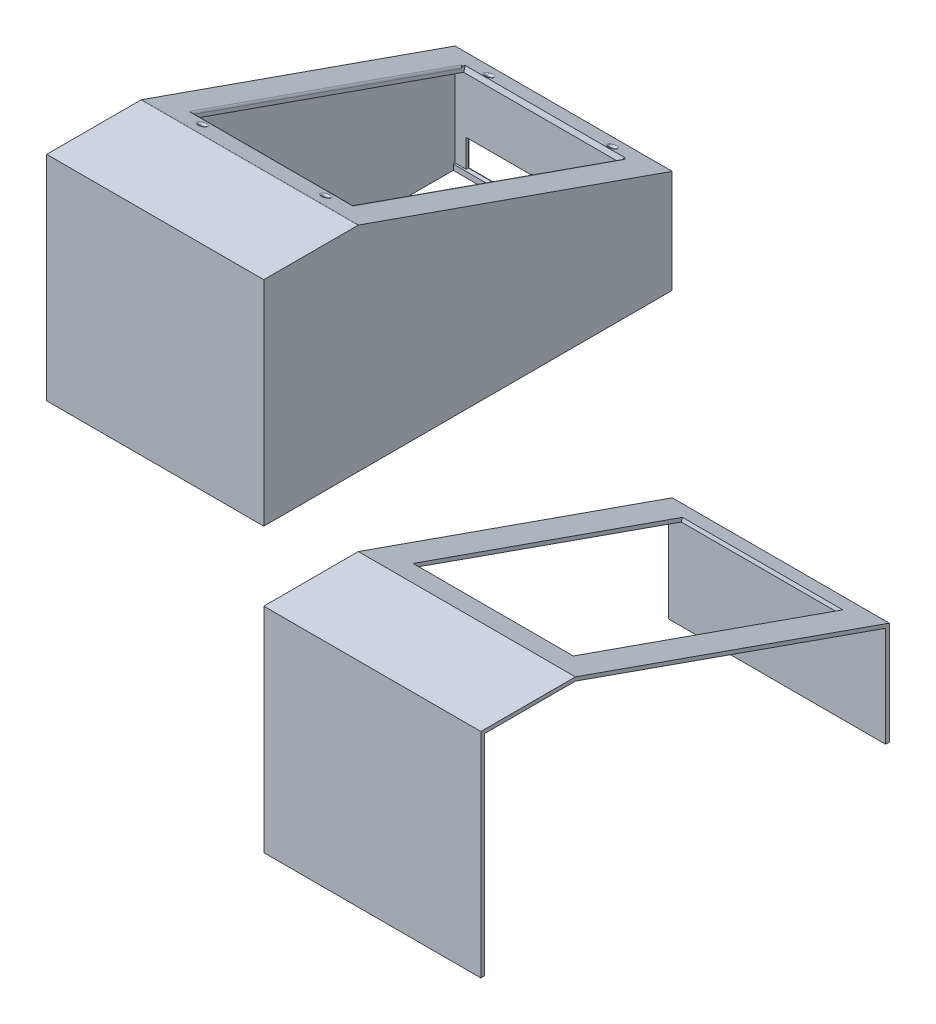
from build123d import *

# Parameters (mm, degrees)
BOSS_EXTRUDE1_DEPTH  = 118
SKETCH2_W            = 44
SKETCH2_H            = 22
CUT_EXTRUDE1_DEPTH   = 118
BOSS_EXTRUDE28_START = -2
SKETCH48_W           = 44
SKETCH48_H           = 2
BOSS_EXTRUDE28_DEPTH = 2
BOSS_EXTRUDE29_START = -2
SKETCH49_W           = 44
SKETCH49_H           = 2.5
BOSS_EXTRUDE29_DEPTH = 2
BOSS_EXTRUDE30_START = -2
SKETCH50_W           = 1.5
SKETCH50_H           = 17.5
SKETCH50_W_2         = 3.5
BOSS_EXTRUDE30_DEPTH = 2
BOSS_EXTRUDE31_START = -2
SKETCH51_W           = 39
SKETCH51_H           = 3.5
BOSS_EXTRUDE31_DEPTH = 2
SKETCH52_W           = 87.1
SKETCH52_H           = 155.2
CUT_EXTRUDE11_DEPTH  = 2
BOSS_EXTRUDE32_DEPTH = 118
SKETCH54_W           = 97.1
SKETCH54_H           = 175.2
BOSS_EXTRUDE33_DEPTH = 1
SKETCH55_W           = 87.1
SKETCH55_H           = 155.2
CUT_EXTRUDE12_DEPTH  = 1
SKETCH56_R           = 2.505902344
SKETCH56_R_2         = 1.5
CUT_EXTRUDE13_DEPTH  = 205.102182183
SKETCH57_R           = 2.505902344
BOSS_EXTRUDE35_DEPTH = 2.886718
SKETCH58_R           = 1.5
CUT_EXTRUDE14_DEPTH  = 205.102182183
SKETCH3_W            = 118
SKETCH3_H            = 2
BOSS_EXTRUDE2_DEPTH  = 114.04
SKETCH5_W            = 39
SKETCH5_H            = 10
BOSS_EXTRUDE3_DEPTH  = 10
SKETCH6_W            = 118
SKETCH6_H            = 2
BOSS_EXTRUDE4_DEPTH  = 1
SKETCH7_W            = 118
SKETCH7_H            = 3.96
CUT_EXTRUDE2_DEPTH   = 272.217672338
BOSS_EXTRUDE5_START  = -2
SKETCH8_W            = 39
SKETCH8_H            = 3
BOSS_EXTRUDE5_DEPTH  = 2
SKETCH9_W            = 2
SKETCH9_H            = 54.743388168
BOSS_EXTRUDE6_DEPTH  = 118
SKETCH12_W           = 44
SKETCH12_H           = 15.04
CUT_EXTRUDE4_DEPTH   = 116
SKETCH59_W           = 5
SKETCH59_H           = 5
CUT_EXTRUDE15_DEPTH  = 10
SKETCH13_W           = 2
SKETCH13_H           = 61.096967507
CUT_EXTRUDE5_DEPTH   = 221.843041507
SKETCH15_W           = 118
SKETCH15_H           = 3
BOSS_EXTRUDE7_DEPTH  = 1
BOSS_EXTRUDE13_DEPTH = 2
BOSS_EXTRUDE16_DEPTH = 2
FILLET9_R            = 1
FILLET10_R           = 1
SKETCH30_W           = 87.1
SKETCH30_H           = 155.2
CUT_EXTRUDE7_DEPTH   = 202.588290111
BOSS_EXTRUDE18_DEPTH = 2
BOSS_EXTRUDE19_DEPTH = 2
BOSS_EXTRUDE20_DEPTH = 118
SKETCH38_W           = 2
SKETCH38_H           = 2
BOSS_EXTRUDE21_DEPTH = 118
SKETCH39_W           = 2
SKETCH39_H           = 2
BOSS_EXTRUDE22_DEPTH = 118
SKETCH40_W           = 2
SKETCH40_H           = 2
BOSS_EXTRUDE23_DEPTH = 118
SKETCH41_W           = 2
SKETCH41_H           = 2
BOSS_EXTRUDE25_DEPTH = 88
BOSS_EXTRUDE26_DEPTH = 118
SKETCH46_W           = 87.1
SKETCH46_H           = 155.2
CUT_EXTRUDE10_DEPTH  = 118


with BuildPart() as part:
    # Sketch1 → Boss-Extrude1 (new body)
    with BuildSketch(Plane(origin=(0, 0, 0), x_dir=(0, 0, -1), z_dir=(1, 0, 0))):
        Polygon((157.338078292, 37.257523043), (50.338078292, 74.888790036), (-13.264734558, 97.257523043), (-64.661921708, 97.257523043), (-64.661921708, 95.257523043), (-13.264734558, 95.257523043), (157.338078292, 35.257523043), (157.338078292, -22.742476957), (159.338078292, -22.742476957), (159.338078292, 36.525800712), align=None)
    extrude(amount=BOSS_EXTRUDE1_DEPTH)

    # Sketch2 → Cut-Extrude1 (cut)
    with BuildSketch(Plane(origin=(0, 0, -159.338078292), x_dir=(-1, 0, 0), z_dir=(0, 0, -1))):
        with Locations((-30, -11.742476957)):
            Rectangle(SKETCH2_W, SKETCH2_H)
    extrude(amount=-CUT_EXTRUDE1_DEPTH, mode=Mode.SUBTRACT)

    # Sketch48 → Boss-Extrude28 (add)
    with BuildSketch(Plane(origin=(0, 0, -159.338078292), x_dir=(-1, 0, 0), z_dir=(0, 0, -1)).offset(BOSS_EXTRUDE28_START)):
        with Locations((-30, -1.742476957)):
            Rectangle(SKETCH48_W, SKETCH48_H)
    extrude(amount=BOSS_EXTRUDE28_DEPTH)

    # Sketch49 → Boss-Extrude29 (add)
    with BuildSketch(Plane(origin=(0, 0, -159.338078292), x_dir=(-1, 0, 0), z_dir=(0, 0, -1)).offset(BOSS_EXTRUDE29_START)):
        with Locations((-30, -3.992476957)):
            Rectangle(SKETCH49_W, SKETCH49_H)
    extrude(amount=BOSS_EXTRUDE29_DEPTH)

    # Sketch50 → Boss-Extrude30 (add)
    with BuildSketch(Plane(origin=(0, 0, -159.338078292), x_dir=(-1, 0, 0), z_dir=(0, 0, -1)).offset(BOSS_EXTRUDE30_START)):
        with Locations((-8.75, -13.992476957)):
            Rectangle(SKETCH50_W, SKETCH50_H)
        with Locations((-50.25, -13.992476957)):
            Rectangle(SKETCH50_W_2, SKETCH50_H)
    extrude(amount=BOSS_EXTRUDE30_DEPTH)

    # Sketch51 → Boss-Extrude31 (add)
    with BuildSketch(Plane(origin=(0, 0, -159.338078292), x_dir=(-1, 0, 0), z_dir=(0, 0, -1)).offset(BOSS_EXTRUDE31_START)):
        with Locations((-29, -20.992476957)):
            Rectangle(SKETCH51_W, SKETCH51_H)
    extrude(amount=BOSS_EXTRUDE31_DEPTH)

    # Sketch52 → Cut-Extrude11 (cut)
    with BuildSketch(Plane(origin=(0, 82.400394348, -28.979731215), x_dir=(1, 0, 0), z_dir=(0, 0.9433589794363793, -0.3317737721953818))):
        with Locations((59, 45.965220001)):
            Rectangle(SKETCH52_W, SKETCH52_H)
    extrude(amount=-CUT_EXTRUDE11_DEPTH, mode=Mode.SUBTRACT)

    # Sketch53 → Boss-Extrude32 (add)
    with BuildSketch(Plane.ZY):
        Polygon((-151.311566761, 39.377011496), (-159.338078292, 36.554134875), (-159.338078292, 36.373260975), (-153.749612575, 38.338691307), align=None)
    extrude(amount=-BOSS_EXTRUDE32_DEPTH)

    # Sketch54 → Boss-Extrude33 (add)
    with BuildSketch(Plane(origin=(0, 80.620542019, -28.35376768), x_dir=(1, 0, 0), z_dir=(0, -0.9433589794363793, 0.3317737721953817))):
        with Locations((59, -45.965220001)):
            Rectangle(SKETCH54_W, SKETCH54_H)
    extrude(amount=BOSS_EXTRUDE33_DEPTH)

    # Sketch55 → Cut-Extrude12 (cut)
    with BuildSketch(Plane(origin=(0, 80.620542019, -28.35376768), x_dir=(1, 0, 0), z_dir=(0, 0.9433589794363793, -0.3317737721953818))):
        with Locations((59, 45.965220001)):
            Rectangle(SKETCH55_W, SKETCH55_H)
    extrude(amount=-CUT_EXTRUDE12_DEPTH, mode=Mode.SUBTRACT)

    # Sketch56 → Cut-Extrude13 (cut, through all)
    with BuildSketch(Plane(origin=(0, 79.67718304, -28.021993908), x_dir=(1, 0, 0), z_dir=(0, -0.9433589794363793, 0.3317737721953818))):
        with Locations(Location((92.55, 36.634779999, 0), (0, 0, 270))):
            Circle(SKETCH56_R)
        with Locations(Location((25.45, 36.634779999, 0), (0, 0, 270))):
            Circle(SKETCH56_R_2)
        with Locations(Location((25.45, -128.565220001, 0), (0, 0, 270))):
            Circle(SKETCH56_R_2)
        with Locations(Location((92.55, -128.565220001, 0), (0, 0, 270))):
            Circle(SKETCH56_R_2)
    extrude(amount=-CUT_EXTRUDE13_DEPTH, mode=Mode.SUBTRACT)

    # Sketch57 → Boss-Extrude35 (add)
    with BuildSketch(Plane(origin=(0, 79.67718304, -28.021993908), x_dir=(1, 0, 0), z_dir=(0, -0.9433589794363793, 0.3317737721953818))):
        with Locations((92.55, 36.634779999)):
            Circle(SKETCH57_R)
    extrude(amount=-BOSS_EXTRUDE35_DEPTH)

    # Sketch58 → Cut-Extrude14 (cut, through all)
    with BuildSketch(Plane(origin=(0, 79.67718304, -28.021993908), x_dir=(1, 0, 0), z_dir=(0, -0.9433589794363793, 0.3317737721953818))):
        with Locations(Location((92.55, 36.634779999, 0), (0, 0, 270))):
            Circle(SKETCH58_R)
    extrude(amount=-CUT_EXTRUDE14_DEPTH, mode=Mode.SUBTRACT)

    # Sketch3 → Boss-Extrude2 (add)
    with BuildSketch(Plane.XZ.offset(-95.257523043)):
        with Locations((59, 63.661921708)):
            Rectangle(SKETCH3_W, SKETCH3_H)
    extrude(amount=BOSS_EXTRUDE2_DEPTH)

    # Sketch5 → Boss-Extrude3 (add)
    with BuildSketch(Plane.XY.offset(64.661921708)):
        with Locations((88.5, -13.782476957)):
            Rectangle(SKETCH5_W, SKETCH5_H)
    extrude(amount=-BOSS_EXTRUDE3_DEPTH)

    # Sketch6 → Boss-Extrude4 (add)
    with BuildSketch(Plane(origin=(0, 0, 62.661921708), x_dir=(-1, 0, 0), z_dir=(0, 0, -1))):
        with Locations((-59, -17.782476957)):
            Rectangle(SKETCH6_W, SKETCH6_H)
    extrude(amount=BOSS_EXTRUDE4_DEPTH)

    # Sketch7 → Cut-Extrude2 (cut, through all)
    with BuildSketch(Plane.XY.offset(64.661921708)):
        with Locations((59, -20.762476957)):
            Rectangle(SKETCH7_W, SKETCH7_H)
    extrude(amount=-CUT_EXTRUDE2_DEPTH, mode=Mode.SUBTRACT)

    # Sketch8 → Boss-Extrude5 (add)
    with BuildSketch(Plane(origin=(0, 0, -159.338078292), x_dir=(-1, 0, 0), z_dir=(0, 0, -1)).offset(BOSS_EXTRUDE5_START)):
        with Locations((-29, -17.282476957)):
            Rectangle(SKETCH8_W, SKETCH8_H)
    extrude(amount=BOSS_EXTRUDE5_DEPTH)

    # Sketch9 → Boss-Extrude6 (add)
    with BuildSketch(Plane.ZY):
        with Locations((-156.338078292, 8.589217127)):
            Rectangle(SKETCH9_W, SKETCH9_H)
    extrude(amount=-BOSS_EXTRUDE6_DEPTH)

    # Sketch12 → Cut-Extrude4 (cut)
    with BuildSketch(Plane(origin=(0, 0, -157.338078292), x_dir=(-1, 0, 0), z_dir=(0, 0, -1))):
        with Locations((-30, -8.262476957)):
            Rectangle(SKETCH12_W, SKETCH12_H)
    extrude(amount=-CUT_EXTRUDE4_DEPTH, mode=Mode.SUBTRACT)

    # Sketch59 → Cut-Extrude15 (cut)
    with BuildSketch(Plane(origin=(0, 0, -159.338078292), x_dir=(-1, 0, 0), z_dir=(0, 0, -1))):
        with Locations((-46, -2.742476957)):
            Rectangle(SKETCH59_W, SKETCH59_H)
    extrude(amount=-CUT_EXTRUDE15_DEPTH, mode=Mode.SUBTRACT)

    # Sketch13 → Cut-Extrude5 (cut, through all)
    with BuildSketch(Plane.ZY):
        with Locations((-158.338078292, 11.766006797)):
            Rectangle(SKETCH13_W, SKETCH13_H)
    extrude(amount=-CUT_EXTRUDE5_DEPTH, mode=Mode.SUBTRACT)

    # Sketch15 → Boss-Extrude7 (add)
    with BuildSketch(Plane.XY.offset(-155.338078292)):
        with Locations((59, -17.282476957)):
            Rectangle(SKETCH15_W, SKETCH15_H)
    extrude(amount=BOSS_EXTRUDE7_DEPTH)

    # Sketch26 → Boss-Extrude13 (add)
    with BuildSketch(Plane(origin=(118, 0, 0), x_dir=(0, 0, -1), z_dir=(1, 0, 0))):
        Polygon((-64.661921708, -18.782476957), (-64.661921708, 97.257523043), (-13.264734558, 97.257523043), (157.338078292, 37.257523043), (157.338078292, -18.782476957), align=None)
    extrude(amount=-BOSS_EXTRUDE13_DEPTH)

    # Sketch28 → Boss-Extrude16 (add)
    with BuildSketch(Plane.ZY):
        Polygon((64.661921708, -18.782476957), (64.661921708, 97.257523043), (13.264734558, 97.257523043), (-157.338078292, 37.257523043), (-157.338078292, -18.782476957), align=None)
    extrude(amount=-BOSS_EXTRUDE16_DEPTH)

    # Fillet9
    fillet9_edges = [part.edges().sort_by_distance(p)[0] for p in [
        (0, 39.237523043, 64.661921708),
        (0, 97.257523043, 38.963328133),
        (15.45, 67.150339918, -72.341434245),
        (59, 92.89598464, 0.86322256),
        (102.55, 67.150339918, -72.341434245),
        (59, 41.404695196, -145.546091049),
        (59, 97.257523043, 13.264734558),
        (59, 97.257523043, 64.661921708),
        (92.55, 40.243486993, -148.847847477),
        (25.45, 40.243486993, -148.847847477),
        (25.45, 95.05251416, 6.995055926),
        (92.55, 95.05251416, 6.995055926),
        (0, -18.782476957, -46.338078292),
        (118, -18.782476957, -46.338078292),
        (59, -18.782476957, 64.661921708),
        (30, -15.782476957, -157.338078292),
        (8, -8.262476957, -157.338078292),
        (25.75, -0.742476957, -157.338078292),
        (52, -8.262476957, -157.338078292),
        (50.25, -0.742476957, -157.338078292),
        (43.5, -0.492476957, -157.338078292),
        (0, 67.257523043, -72.036671867),
        (118, 67.257523043, -72.036671867),
        (0, 9.237523043, -157.338078292),
        (46, -0.242476957, -157.338078292),
        (118, 9.237523043, -157.338078292),
        (59, 37.257523043, -157.338078292),
        (48.5, -0.492476957, -157.338078292),
        (59, -18.782476957, -157.338078292),
        (118, 97.257523043, 38.963328133),
        (118, 39.237523043, 64.661921708),
    ]]
    fillet(fillet9_edges, radius=FILLET9_R)

    # Fillet10
    # the kernel refuses this fillet: 1 mm, written as the material it adds along each edge
    with BuildSketch(Plane(origin=(3, 94.257523043, 13.435456373), x_dir=(0, 1, 0), z_dir=(-1, 0, 0))) as fillet10_piece_1_section:
        Polygon((0, 0), (FILLET10_R * 1.02, 0), (FILLET10_R * 1.02, FILLET10_R * 0.174136251315), (FILLET10_R * 0.962226159025, FILLET10_R * 0.338409247639), align=None)
    fillet10_piece_1 = extrude(amount=FILLET10_R * 1.02, mode=Mode.PRIVATE)
    fillet10_piece_1 = fillet10_piece_1 - Plane(origin=(3, 94.257523043, 13.435456373), x_dir=(0, -0.9857380431525353, 0.16828698785648993), z_dir=(-1, 0, 0)) * Sphere(FILLET10_R, mode=Mode.PRIVATE)
    add(fillet10_piece_1)
    with BuildSketch(Plane(origin=(115, 94.257523043, 13.435456373), x_dir=(0, 0.9433589794363793, -0.33177377219538173), z_dir=(1, 0, 0))) as fillet10_piece_2_section:
        Polygon((0, 0), (FILLET10_R * 1.02, 0), (FILLET10_R * 1.02, FILLET10_R * 0.174136251315), (FILLET10_R * 0.962226159025, FILLET10_R * 0.338409247639), align=None)
    fillet10_piece_2 = extrude(amount=FILLET10_R * 1.02, mode=Mode.PRIVATE)
    fillet10_piece_2 = fillet10_piece_2 - Plane(origin=(115, 94.257523043, 13.435456373), x_dir=(0, -0.9857380431525353, 0.16828698785648993), z_dir=(1, 0, 0)) * Sphere(FILLET10_R, mode=Mode.PRIVATE)
    add(fillet10_piece_2)
    with BuildSketch(Plane(origin=(115, 94.257523043, 61.661921708), x_dir=(0, 0, 1), z_dir=(1, 0, 0))) as fillet10_piece_3_section:
        Polygon((0, 0), (FILLET10_R * 1.02, 0), (FILLET10_R * 1.02, -FILLET10_R * 1.02), (0, -FILLET10_R * 1.02), align=None)
    fillet10_piece_3 = extrude(amount=FILLET10_R * 1.02, mode=Mode.PRIVATE)
    fillet10_piece_3 = fillet10_piece_3 - Plane(origin=(115, 94.257523043, 61.661921708), x_dir=(0, -0.7071067811865475, -0.7071067811865475), z_dir=(1, 0, 0)) * Sphere(FILLET10_R, mode=Mode.PRIVATE)
    add(fillet10_piece_3)
    with BuildSketch(Plane(origin=(3, 94.257523043, 61.661921708), x_dir=(-1, 0, 0), z_dir=(0, 0, 1))) as fillet10_piece_4_section:
        Polygon((0, 0), (FILLET10_R * 1.02, 0), (FILLET10_R * 1.02, -FILLET10_R * 1.02), (0, -FILLET10_R * 1.02), align=None)
    fillet10_piece_4 = extrude(amount=FILLET10_R * 1.02, mode=Mode.PRIVATE)
    fillet10_piece_4 = fillet10_piece_4 - Plane(origin=(3, 94.257523043, 61.661921708), x_dir=(0.7071067811865475, -0.7071067811865475, 0), z_dir=(0, 0, 1)) * Sphere(FILLET10_R, mode=Mode.PRIVATE)
    add(fillet10_piece_4)
    with BuildSketch(Plane(origin=(3, 95.257523043, 13.264734558), x_dir=(0, -0.3317737721953566, -0.943358979436388), z_dir=(1, 0, 0))) as fillet10_piece_5:
        with BuildLine():
            CenterArc((FILLET10_R * 0.170721815015, -FILLET10_R), FILLET10_R, 90, 19.376471652)
            Line((-FILLET10_R * 0.16105195718, -FILLET10_R * 0.0566410205636), (-FILLET10_R * 0.167687432624, -FILLET10_R * 0.0377738409749))
            Line((-FILLET10_R * 0.167687432624, -FILLET10_R * 0.0377738409749), (-FILLET10_R * 0.0034144363003, FILLET10_R * 0.02))
            Line((-FILLET10_R * 0.0034144363003, FILLET10_R * 0.02), (FILLET10_R * 0.170721815015, FILLET10_R * 0.02))
            Line((FILLET10_R * 0.170721815015, FILLET10_R * 0.02), (FILLET10_R * 0.170721815015, 0))
        make_face()
    extrude(amount=112)
    with BuildSketch(Plane(origin=(116, 35.131476781, -157.69647574), x_dir=(-1, 0, 0), z_dir=(0, 0.33177377219538173, 0.9433589794363793))) as fillet10_piece_6_section:
        with BuildLine():
            CenterArc((FILLET10_R, FILLET10_R), FILLET10_R, 180, 90)
            Line((0, FILLET10_R), (-FILLET10_R * 0.02, FILLET10_R))
            Line((-FILLET10_R * 0.02, FILLET10_R), (-FILLET10_R * 0.02, -FILLET10_R * 0.02))
            Line((-FILLET10_R * 0.02, -FILLET10_R * 0.02), (FILLET10_R, -FILLET10_R * 0.02))
            Line((FILLET10_R, -FILLET10_R * 0.02), (FILLET10_R, 0))
        make_face()
    fillet10_piece_6 = extrude(amount=181.055316231, mode=Mode.PRIVATE)
    fillet10_piece_6 = split(fillet10_piece_6, bisect_by=Plane(origin=(115.773658942, 65.354024879, -155.338078292), z_dir=(0, 0, 1)), keep=Keep.TOP, mode=Mode.PRIVATE)
    add(fillet10_piece_6)
    with BuildSketch(Plane(origin=(2, 35.960911211, -155.338078292), x_dir=(0, 0.3317737721953593, 0.9433589794363871), z_dir=(1, 0, 0))) as fillet10_piece_7:
        with BuildLine():
            CenterArc((FILLET10_R * 0.708347768316, FILLET10_R), FILLET10_R, 199.376471652, 70.623528348)
            Line((-FILLET10_R * 0.23501121112, FILLET10_R * 0.668226227805), (-FILLET10_R * 0.253878390709, FILLET10_R * 0.661590752361))
            Line((-FILLET10_R * 0.253878390709, FILLET10_R * 0.661590752361), (-FILLET10_R * 0.0141669553663, -FILLET10_R * 0.02))
            Line((-FILLET10_R * 0.0141669553663, -FILLET10_R * 0.02), (FILLET10_R * 0.708347768316, -FILLET10_R * 0.02))
            Line((FILLET10_R * 0.708347768316, -FILLET10_R * 0.02), (FILLET10_R * 0.708347768316, 0))
        make_face()
    extrude(amount=114)
    with BuildSketch(Plane(origin=(2, 35.131476781, -157.69647574), x_dir=(1, 0, 0), z_dir=(0, 0.33177377219538173, 0.9433589794363793))) as fillet10_piece_8_section:
        with BuildLine():
            CenterArc((FILLET10_R, -FILLET10_R), FILLET10_R, 90, 90)
            Line((0, -FILLET10_R), (-FILLET10_R * 0.02, -FILLET10_R))
            Line((-FILLET10_R * 0.02, -FILLET10_R), (-FILLET10_R * 0.02, FILLET10_R * 0.02))
            Line((-FILLET10_R * 0.02, FILLET10_R * 0.02), (FILLET10_R, FILLET10_R * 0.02))
            Line((FILLET10_R, FILLET10_R * 0.02), (FILLET10_R, 0))
        make_face()
    fillet10_piece_8 = extrude(amount=181.055316231, mode=Mode.PRIVATE)
    fillet10_piece_8 = split(fillet10_piece_8, bisect_by=Plane(origin=(2.226341058, 65.354024879, -155.338078292), z_dir=(0, 0, 1)), keep=Keep.TOP, mode=Mode.PRIVATE)
    add(fillet10_piece_8)
    with BuildSketch(Plane(origin=(116, 95.257523043, 13.435456373), x_dir=(0, -1, 0), z_dir=(0, 0, 1))) as fillet10_piece_9:
        with BuildLine():
            CenterArc((FILLET10_R, -FILLET10_R), FILLET10_R, 90, 90)
            Line((0, -FILLET10_R), (-FILLET10_R * 0.02, -FILLET10_R))
            Line((-FILLET10_R * 0.02, -FILLET10_R), (-FILLET10_R * 0.02, FILLET10_R * 0.02))
            Line((-FILLET10_R * 0.02, FILLET10_R * 0.02), (FILLET10_R, FILLET10_R * 0.02))
            Line((FILLET10_R, FILLET10_R * 0.02), (FILLET10_R, 0))
        make_face()
    extrude(amount=48.226465336)
    with BuildSketch(Plane(origin=(116, -16.782476957, 62.661921708), x_dir=(0, 0, -1), z_dir=(0, 1, 0))) as fillet10_piece_10:
        with BuildLine():
            CenterArc((FILLET10_R, FILLET10_R), FILLET10_R, 180, 90)
            Line((0, FILLET10_R), (-FILLET10_R * 0.02, FILLET10_R))
            Line((-FILLET10_R * 0.02, FILLET10_R), (-FILLET10_R * 0.02, -FILLET10_R * 0.02))
            Line((-FILLET10_R * 0.02, -FILLET10_R * 0.02), (FILLET10_R, -FILLET10_R * 0.02))
            Line((FILLET10_R, -FILLET10_R * 0.02), (FILLET10_R, 0))
        make_face()
    extrude(amount=111.04)
    with BuildSketch(Plane(origin=(2, -16.782476957, 62.661921708), x_dir=(0, 0, -1), z_dir=(0, 1, 0))) as fillet10_piece_11:
        with BuildLine():
            CenterArc((FILLET10_R, -FILLET10_R), FILLET10_R, 90, 90)
            Line((0, -FILLET10_R), (-FILLET10_R * 0.02, -FILLET10_R))
            Line((-FILLET10_R * 0.02, -FILLET10_R), (-FILLET10_R * 0.02, FILLET10_R * 0.02))
            Line((-FILLET10_R * 0.02, FILLET10_R * 0.02), (FILLET10_R, FILLET10_R * 0.02))
            Line((FILLET10_R, FILLET10_R * 0.02), (FILLET10_R, 0))
        make_face()
    extrude(amount=111.04)
    with BuildSketch(Plane(origin=(115, 95.257523043, 62.661921708), x_dir=(0, 0, -1), z_dir=(-1, 0, 0))) as fillet10_piece_12:
        with BuildLine():
            CenterArc((FILLET10_R, FILLET10_R), FILLET10_R, 180, 90)
            Line((0, FILLET10_R), (-FILLET10_R * 0.02, FILLET10_R))
            Line((-FILLET10_R * 0.02, FILLET10_R), (-FILLET10_R * 0.02, -FILLET10_R * 0.02))
            Line((-FILLET10_R * 0.02, -FILLET10_R * 0.02), (FILLET10_R, -FILLET10_R * 0.02))
            Line((FILLET10_R, -FILLET10_R * 0.02), (FILLET10_R, 0))
        make_face()
    extrude(amount=112)
    with BuildSketch(Plane(origin=(2, 95.257523043, 13.435456373), x_dir=(0, -1, 0), z_dir=(0, 0, 1))) as fillet10_piece_13:
        with BuildLine():
            CenterArc((FILLET10_R, FILLET10_R), FILLET10_R, 180, 90)
            Line((0, FILLET10_R), (-FILLET10_R * 0.02, FILLET10_R))
            Line((-FILLET10_R * 0.02, FILLET10_R), (-FILLET10_R * 0.02, -FILLET10_R * 0.02))
            Line((-FILLET10_R * 0.02, -FILLET10_R * 0.02), (FILLET10_R, -FILLET10_R * 0.02))
            Line((FILLET10_R, -FILLET10_R * 0.02), (FILLET10_R, 0))
        make_face()
    extrude(amount=48.226465336)
    with BuildSketch(Plane(origin=(107.55, 94.433870034, 10.922775888), x_dir=(0, -0.9433589794363803, 0.3317737721953789), z_dir=(-1, 0, 0)), Plane(origin=(10.45, 36.307105145, -154.353717309), x_dir=(0, -0.9433589794363769, 0.3317737721953884), z_dir=(1, 0, 0))) as fillet10_piece_14:
        with BuildLine():
            CenterArc((FILLET10_R, FILLET10_R), FILLET10_R, 180, 90)
            Line((0, FILLET10_R), (-FILLET10_R * 0.02, FILLET10_R))
            Line((-FILLET10_R * 0.02, FILLET10_R), (-FILLET10_R * 0.02, -FILLET10_R * 0.02))
            Line((-FILLET10_R * 0.02, -FILLET10_R * 0.02), (FILLET10_R, -FILLET10_R * 0.02))
            Line((FILLET10_R, -FILLET10_R * 0.02), (FILLET10_R, 0))
        make_face()
    extrude(amount=97.1)
    with BuildSketch(Plane(origin=(10.45, 94.433870034, 10.922775888), x_dir=(0, -0.9433589794363793, 0.3317737721953817), z_dir=(0, -0.3317737721953817, -0.9433589794363793)), Plane(origin=(107.55, 36.307105145, -154.353717309), x_dir=(0, -0.9433589794363793, 0.33177377219538173), z_dir=(0, 0.3317737721953817, 0.9433589794363793))) as fillet10_piece_15:
        with BuildLine():
            CenterArc((FILLET10_R, FILLET10_R), FILLET10_R, 180, 90)
            Line((0, FILLET10_R), (-FILLET10_R * 0.02, FILLET10_R))
            Line((-FILLET10_R * 0.02, FILLET10_R), (-FILLET10_R * 0.02, -FILLET10_R * 0.02))
            Line((-FILLET10_R * 0.02, -FILLET10_R * 0.02), (FILLET10_R, -FILLET10_R * 0.02))
            Line((FILLET10_R, -FILLET10_R * 0.02), (FILLET10_R, 0))
        make_face()
    extrude(amount=175.2)
    with BuildSketch(Plane(origin=(2, 35.960911211, -155.338078292), x_dir=(0, 0.3317737721953593, 0.9433589794363871), z_dir=(1, 0, 0))) as fillet10_piece_16a_section:
        with BuildLine():
            CenterArc((FILLET10_R * 0.708347768316, FILLET10_R), FILLET10_R, 199.376471652, 70.623528348)
            Line((-FILLET10_R * 0.23501121112, FILLET10_R * 0.668226227805), (-FILLET10_R * 0.253878390709, FILLET10_R * 0.661590752361))
            Line((-FILLET10_R * 0.253878390709, FILLET10_R * 0.661590752361), (-FILLET10_R * 0.0141669553663, -FILLET10_R * 0.02))
            Line((-FILLET10_R * 0.0141669553663, -FILLET10_R * 0.02), (FILLET10_R * 0.708347768316, -FILLET10_R * 0.02))
            Line((FILLET10_R * 0.708347768316, -FILLET10_R * 0.02), (FILLET10_R * 0.708347768316, 0))
        make_face()
    fillet10_piece_16a = extrude(amount=115.770869421, mode=Mode.PRIVATE)
    fillet10_piece_16a = split(fillet10_piece_16a, bisect_by=Plane(origin=(116, 35.857039201, -155.191438443), z_dir=(1, 0, 0)), keep=Keep.TOP, mode=Mode.PRIVATE)
    with BuildSketch(Plane(origin=(116, 35.131476781, -157.69647574), x_dir=(-1, 0, 0), z_dir=(0, 0.33177377219538173, 0.9433589794363793))) as fillet10_piece_16b_section:
        with BuildLine():
            CenterArc((FILLET10_R, FILLET10_R), FILLET10_R, 180, 90)
            Line((0, FILLET10_R), (-FILLET10_R * 0.02, FILLET10_R))
            Line((-FILLET10_R * 0.02, FILLET10_R), (-FILLET10_R * 0.02, -FILLET10_R * 0.02))
            Line((-FILLET10_R * 0.02, -FILLET10_R * 0.02), (FILLET10_R, -FILLET10_R * 0.02))
            Line((FILLET10_R, -FILLET10_R * 0.02), (FILLET10_R, 0))
        make_face()
    fillet10_piece_16b = extrude(amount=181.055316231, mode=Mode.PRIVATE)
    fillet10_piece_16b = split(fillet10_piece_16b, bisect_by=Plane(origin=(115.769615277, 35.326178707, -155.338078292), z_dir=(0, 0, -1)), keep=Keep.TOP, mode=Mode.PRIVATE)
    fillet10_piece_16 = fillet10_piece_16a & fillet10_piece_16b
    add(fillet10_piece_16)
    with BuildSketch(Plane(origin=(2, 35.131476781, -157.69647574), x_dir=(1, 0, 0), z_dir=(0, 0.33177377219538173, 0.9433589794363793))) as fillet10_piece_17a_section:
        with BuildLine():
            CenterArc((FILLET10_R, -FILLET10_R), FILLET10_R, 90, 90)
            Line((0, -FILLET10_R), (-FILLET10_R * 0.02, -FILLET10_R))
            Line((-FILLET10_R * 0.02, -FILLET10_R), (-FILLET10_R * 0.02, FILLET10_R * 0.02))
            Line((-FILLET10_R * 0.02, FILLET10_R * 0.02), (FILLET10_R, FILLET10_R * 0.02))
            Line((FILLET10_R, FILLET10_R * 0.02), (FILLET10_R, 0))
        make_face()
    fillet10_piece_17a = extrude(amount=181.055316231, mode=Mode.PRIVATE)
    fillet10_piece_17a = split(fillet10_piece_17a, bisect_by=Plane(origin=(2.230384723, 35.326178707, -155.338078292), z_dir=(0, 0, -1)), keep=Keep.TOP, mode=Mode.PRIVATE)
    with BuildSketch(Plane(origin=(0.229130579, 35.960911211, -155.338078292), x_dir=(0, 0.3317737721953682, 0.9433589794363839), z_dir=(1, 0, 0))) as fillet10_piece_17b_section:
        with BuildLine():
            CenterArc((FILLET10_R * 0.708347768316, FILLET10_R), FILLET10_R, 199.376471652, 70.623528348)
            Line((-FILLET10_R * 0.23501121112, FILLET10_R * 0.668226227805), (-FILLET10_R * 0.253878390709, FILLET10_R * 0.661590752361))
            Line((-FILLET10_R * 0.253878390709, FILLET10_R * 0.661590752361), (-FILLET10_R * 0.0141669553663, -FILLET10_R * 0.02))
            Line((-FILLET10_R * 0.0141669553663, -FILLET10_R * 0.02), (FILLET10_R * 0.708347768316, -FILLET10_R * 0.02))
            Line((FILLET10_R * 0.708347768316, -FILLET10_R * 0.02), (FILLET10_R * 0.708347768316, 0))
        make_face()
    fillet10_piece_17b = extrude(amount=115.770869421, mode=Mode.PRIVATE)
    fillet10_piece_17b = split(fillet10_piece_17b, bisect_by=Plane(origin=(2, 35.857039201, -155.191438443), z_dir=(-1, 0, 0)), keep=Keep.TOP, mode=Mode.PRIVATE)
    fillet10_piece_17 = fillet10_piece_17a & fillet10_piece_17b
    add(fillet10_piece_17)
    with BuildSketch(Plane(origin=(107.55, 36.307105145, -154.353717309), x_dir=(0, -0.9433589794363793, 0.33177377219538173), z_dir=(0, 0.3317737721953817, 0.9433589794363793))) as fillet10_piece_18a_section:
        with BuildLine():
            CenterArc((FILLET10_R, FILLET10_R), FILLET10_R, 180, 90)
            Line((0, FILLET10_R), (-FILLET10_R * 0.02, FILLET10_R))
            Line((-FILLET10_R * 0.02, FILLET10_R), (-FILLET10_R * 0.02, -FILLET10_R * 0.02))
            Line((-FILLET10_R * 0.02, -FILLET10_R * 0.02), (FILLET10_R, -FILLET10_R * 0.02))
            Line((FILLET10_R, -FILLET10_R * 0.02), (FILLET10_R, 0))
        make_face()
    fillet10_piece_18a = extrude(amount=177.7, mode=Mode.PRIVATE)
    fillet10_piece_18a = split(fillet10_piece_18a, bisect_by=Plane(origin=(107.776395114, 94.22029817, 10.997887849), z_dir=(0, 0.3317737721953817, 0.9433589794363793)), keep=Keep.TOP, mode=Mode.PRIVATE)
    with BuildSketch(Plane(origin=(110.05, 94.433870034, 10.922775888), x_dir=(0, -0.9433589794363803, 0.3317737721953789), z_dir=(-1, 0, 0))) as fillet10_piece_18b_section:
        with BuildLine():
            CenterArc((FILLET10_R, FILLET10_R), FILLET10_R, 180, 90)
            Line((0, FILLET10_R), (-FILLET10_R * 0.02, FILLET10_R))
            Line((-FILLET10_R * 0.02, FILLET10_R), (-FILLET10_R * 0.02, -FILLET10_R * 0.02))
            Line((-FILLET10_R * 0.02, -FILLET10_R * 0.02), (FILLET10_R, -FILLET10_R * 0.02))
            Line((FILLET10_R, -FILLET10_R * 0.02), (FILLET10_R, 0))
        make_face()
    fillet10_piece_18b = extrude(amount=99.6, mode=Mode.PRIVATE)
    fillet10_piece_18b = split(fillet10_piece_18b, bisect_by=Plane(origin=(107.55, 94.295410131, 11.211459713), z_dir=(1, 0, 0)), keep=Keep.TOP, mode=Mode.PRIVATE)
    fillet10_piece_18 = fillet10_piece_18a & fillet10_piece_18b
    add(fillet10_piece_18)
    with BuildSketch(Plane(origin=(10.45, 95.263304465, 13.281173337), x_dir=(0, -0.9433589794363794, 0.33177377219538173), z_dir=(0, -0.3317737721953817, -0.9433589794363793))) as fillet10_piece_19a_section:
        with BuildLine():
            CenterArc((FILLET10_R, FILLET10_R), FILLET10_R, 180, 90)
            Line((0, FILLET10_R), (-FILLET10_R * 0.02, FILLET10_R))
            Line((-FILLET10_R * 0.02, FILLET10_R), (-FILLET10_R * 0.02, -FILLET10_R * 0.02))
            Line((-FILLET10_R * 0.02, -FILLET10_R * 0.02), (FILLET10_R, -FILLET10_R * 0.02))
            Line((FILLET10_R, -FILLET10_R * 0.02), (FILLET10_R, 0))
        make_face()
    fillet10_piece_19a = extrude(amount=177.7, mode=Mode.PRIVATE)
    fillet10_piece_19a = split(fillet10_piece_19a, bisect_by=Plane(origin=(10.223604886, 94.22029817, 10.997887849), z_dir=(0, 0.3317737721953817, 0.9433589794363793)), keep=Keep.TOP, mode=Mode.PRIVATE)
    with BuildSketch(Plane(origin=(107.55, 94.433870034, 10.922775888), x_dir=(0, -0.9433589794363803, 0.3317737721953789), z_dir=(-1, 0, 0))) as fillet10_piece_19b_section:
        with BuildLine():
            CenterArc((FILLET10_R, FILLET10_R), FILLET10_R, 180, 90)
            Line((0, FILLET10_R), (-FILLET10_R * 0.02, FILLET10_R))
            Line((-FILLET10_R * 0.02, FILLET10_R), (-FILLET10_R * 0.02, -FILLET10_R * 0.02))
            Line((-FILLET10_R * 0.02, -FILLET10_R * 0.02), (FILLET10_R, -FILLET10_R * 0.02))
            Line((FILLET10_R, -FILLET10_R * 0.02), (FILLET10_R, 0))
        make_face()
    fillet10_piece_19b = extrude(amount=99.6, mode=Mode.PRIVATE)
    fillet10_piece_19b = split(fillet10_piece_19b, bisect_by=Plane(origin=(10.45, 94.295410131, 11.211459713), z_dir=(-1, 0, 0)), keep=Keep.TOP, mode=Mode.PRIVATE)
    fillet10_piece_19 = fillet10_piece_19a & fillet10_piece_19b
    add(fillet10_piece_19)
    with BuildSketch(Plane(origin=(7.95, 36.307105145, -154.353717309), x_dir=(0, -0.9433589794363777, 0.3317737721953862), z_dir=(1, 0, 0))) as fillet10_piece_20a_section:
        with BuildLine():
            CenterArc((FILLET10_R, FILLET10_R), FILLET10_R, 180, 90)
            Line((0, FILLET10_R), (-FILLET10_R * 0.02, FILLET10_R))
            Line((-FILLET10_R * 0.02, FILLET10_R), (-FILLET10_R * 0.02, -FILLET10_R * 0.02))
            Line((-FILLET10_R * 0.02, -FILLET10_R * 0.02), (FILLET10_R, -FILLET10_R * 0.02))
            Line((FILLET10_R, -FILLET10_R * 0.02), (FILLET10_R, 0))
        make_face()
    fillet10_piece_20a = extrude(amount=99.6, mode=Mode.PRIVATE)
    fillet10_piece_20a = split(fillet10_piece_20a, bisect_by=Plane(origin=(10.45, 36.01842132, -154.492177212), z_dir=(-1, 0, 0)), keep=Keep.TOP, mode=Mode.PRIVATE)
    with BuildSketch(Plane(origin=(10.45, 94.433870034, 10.922775888), x_dir=(0, -0.9433589794363793, 0.3317737721953817), z_dir=(0, -0.3317737721953817, -0.9433589794363793))) as fillet10_piece_20b_section:
        with BuildLine():
            CenterArc((FILLET10_R, FILLET10_R), FILLET10_R, 180, 90)
            Line((0, FILLET10_R), (-FILLET10_R * 0.02, FILLET10_R))
            Line((-FILLET10_R * 0.02, FILLET10_R), (-FILLET10_R * 0.02, -FILLET10_R * 0.02))
            Line((-FILLET10_R * 0.02, -FILLET10_R * 0.02), (FILLET10_R, -FILLET10_R * 0.02))
            Line((FILLET10_R, -FILLET10_R * 0.02), (FILLET10_R, 0))
        make_face()
    fillet10_piece_20b = extrude(amount=177.7, mode=Mode.PRIVATE)
    fillet10_piece_20b = split(fillet10_piece_20b, bisect_by=Plane(origin=(10.223604886, 36.093533282, -154.278605348), z_dir=(0, -0.3317737721953817, -0.9433589794363793)), keep=Keep.TOP, mode=Mode.PRIVATE)
    fillet10_piece_20 = fillet10_piece_20a & fillet10_piece_20b
    add(fillet10_piece_20)
    with BuildSketch(Plane(origin=(10.45, 36.307105145, -154.353717309), x_dir=(0, -0.9433589794363769, 0.3317737721953884), z_dir=(1, 0, 0))) as fillet10_piece_21a_section:
        with BuildLine():
            CenterArc((FILLET10_R, FILLET10_R), FILLET10_R, 180, 90)
            Line((0, FILLET10_R), (-FILLET10_R * 0.02, FILLET10_R))
            Line((-FILLET10_R * 0.02, FILLET10_R), (-FILLET10_R * 0.02, -FILLET10_R * 0.02))
            Line((-FILLET10_R * 0.02, -FILLET10_R * 0.02), (FILLET10_R, -FILLET10_R * 0.02))
            Line((FILLET10_R, -FILLET10_R * 0.02), (FILLET10_R, 0))
        make_face()
    fillet10_piece_21a = extrude(amount=99.6, mode=Mode.PRIVATE)
    fillet10_piece_21a = split(fillet10_piece_21a, bisect_by=Plane(origin=(107.55, 36.01842132, -154.492177212), z_dir=(1, 0, 0)), keep=Keep.TOP, mode=Mode.PRIVATE)
    with BuildSketch(Plane(origin=(107.55, 35.477670715, -156.712114758), x_dir=(0, -0.9433589794363793, 0.3317737721953816), z_dir=(0, 0.3317737721953817, 0.9433589794363793))) as fillet10_piece_21b_section:
        with BuildLine():
            CenterArc((FILLET10_R, FILLET10_R), FILLET10_R, 180, 90)
            Line((0, FILLET10_R), (-FILLET10_R * 0.02, FILLET10_R))
            Line((-FILLET10_R * 0.02, FILLET10_R), (-FILLET10_R * 0.02, -FILLET10_R * 0.02))
            Line((-FILLET10_R * 0.02, -FILLET10_R * 0.02), (FILLET10_R, -FILLET10_R * 0.02))
            Line((FILLET10_R, -FILLET10_R * 0.02), (FILLET10_R, 0))
        make_face()
    fillet10_piece_21b = extrude(amount=177.7, mode=Mode.PRIVATE)
    fillet10_piece_21b = split(fillet10_piece_21b, bisect_by=Plane(origin=(107.776395114, 36.093533282, -154.278605348), z_dir=(0, -0.3317737721953817, -0.9433589794363793)), keep=Keep.TOP, mode=Mode.PRIVATE)
    fillet10_piece_21 = fillet10_piece_21a & fillet10_piece_21b
    add(fillet10_piece_21)

    # Sketch30 → Cut-Extrude7 (cut, through all)
    with BuildSketch(Plane(origin=(0, 82.400394348, -28.979731215), x_dir=(1, 0, 0), z_dir=(0, 0.9433589794363793, -0.3317737721953818))):
        with Locations((59, 47.989820066)):
            Rectangle(SKETCH30_W, SKETCH30_H)
    extrude(amount=-CUT_EXTRUDE7_DEPTH, mode=Mode.SUBTRACT)

    # Sketch35 → Boss-Extrude18 (add)
    with BuildSketch(Plane(origin=(118, 0, 0), x_dir=(0, 0, -1), z_dir=(1, 0, 0))):
        Polygon((-13.1036826, 97.200882023), (157.338078292, 37.257523043), (157.338078292, -18.782476957), (-64.661921708, -18.782476957), (-64.661921708, 97.257523043), (-13.435456373, 97.257523043), (-13.264734558, 97.257523043), align=None)
    extrude(amount=-BOSS_EXTRUDE18_DEPTH)

    # Sketch36 → Boss-Extrude19 (add)
    with BuildSketch(Plane.ZY):
        Polygon((64.661921708, 97.257523043), (64.661921708, -18.782476957), (-157.338078292, -18.782476957), (-157.338078292, 37.257523043), (13.264734558, 97.257523043), align=None)
    extrude(amount=-BOSS_EXTRUDE19_DEPTH)

    # Sketch37 → Boss-Extrude20 (add)
    with BuildSketch(Plane.ZY):
        Polygon((-157.338078292, 33.928651814), (-155.338078292, 33.928651814), (-155.338078292, 37.960911211), (-157.338078292, 37.257523043), align=None)
    extrude(amount=-BOSS_EXTRUDE20_DEPTH)

    # Sketch38 → Boss-Extrude21 (add)
    with BuildSketch(Plane.ZY):
        with Locations((63.661921708, 96.257523043)):
            Rectangle(SKETCH38_W, SKETCH38_H)
    extrude(amount=-BOSS_EXTRUDE21_DEPTH)

    # Sketch39 → Boss-Extrude22 (add)
    with BuildSketch(Plane.ZY):
        with Locations((63.661921708, -17.782476957)):
            Rectangle(SKETCH39_W, SKETCH39_H)
    extrude(amount=-BOSS_EXTRUDE22_DEPTH)

    # Sketch40 → Boss-Extrude23 (add)
    with BuildSketch(Plane.ZY):
        with Locations((-156.338078292, -17.782476957)):
            Rectangle(SKETCH40_W, SKETCH40_H)
    extrude(amount=-BOSS_EXTRUDE23_DEPTH)

    # Sketch41 → Boss-Extrude25 (add)
    with BuildSketch(Plane(origin=(0, 97.257523043, 0), x_dir=(1, 0, 0), z_dir=(0, 1, 0))):
        with Locations((117, -63.661921708)):
            Rectangle(SKETCH41_W, SKETCH41_H)
        with Locations((1, -63.661921708)):
            Rectangle(SKETCH41_W, SKETCH41_H)
    extrude(amount=-BOSS_EXTRUDE25_DEPTH)


with BuildPart() as body_2:
    # Sketch42 → Boss-Extrude26 (new body)
    with BuildSketch(Plane(origin=(118, 0, 0), x_dir=(0, 0, -1), z_dir=(1, 0, 0))):
        Polygon((-64.661921708, -56.411790511), (-64.661921708, -172.451790511), (-62.661921708, -172.451790511), (-62.661921708, -58.411790511), (-13.264734558, -58.411790511), (155.338078292, -117.828486048), (155.338078292, -123.746764473), (155.338078292, -172.451790511), (157.338078292, -172.451790511), (157.338078292, -116.411790511), (-13.264734558, -56.411790511), align=None)
    extrude(amount=BOSS_EXTRUDE26_DEPTH)

    # Sketch46 → Cut-Extrude10 (cut)
    with BuildSketch(Plane(origin=(0, -54.353948401, 19.115962097), x_dir=(1, 0, 0), z_dir=(0, 0.9433589794363799, -0.33177377219537973))):
        with Locations((177, 98.96866783)):
            Rectangle(SKETCH46_W, SKETCH46_H)
    extrude(amount=-CUT_EXTRUDE10_DEPTH, mode=Mode.SUBTRACT)


solid = Compound([part.part, body_2.part])
